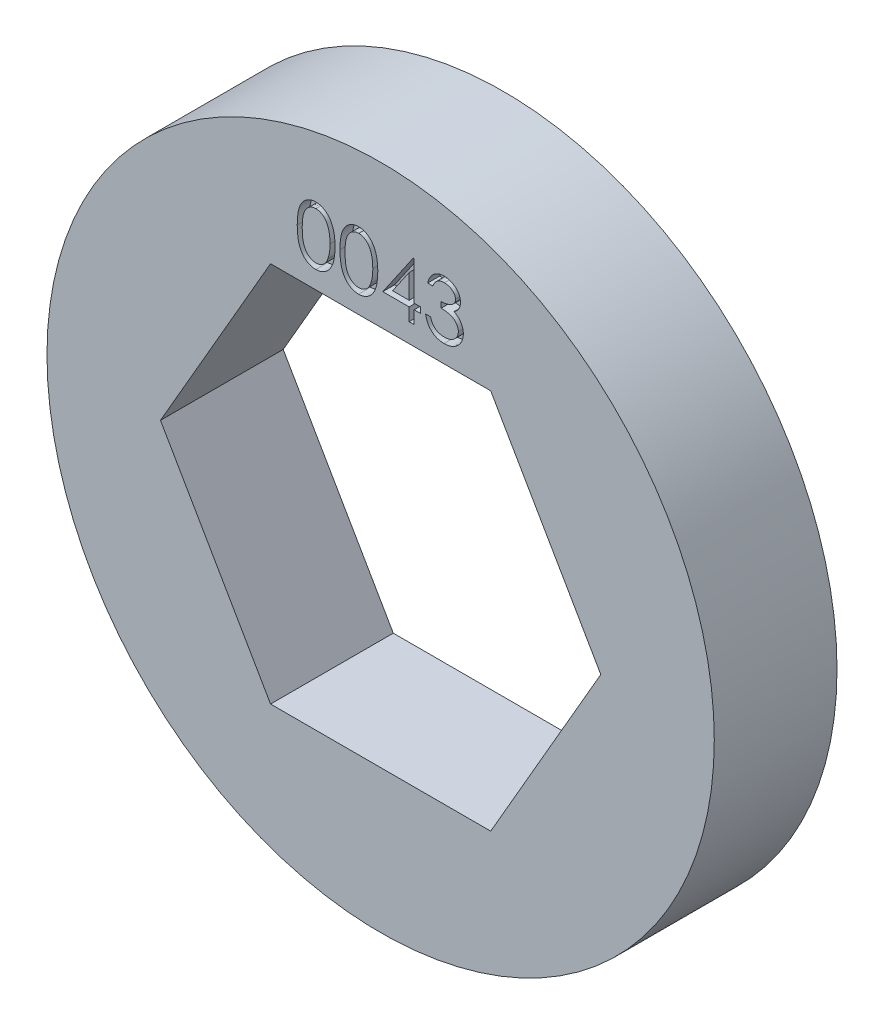
from build123d import *

# Parameters (mm, degrees)
SKETCH1_R           = 11.1125
BOSS_EXTRUDE1_DEPTH = 4.087622
CUT_EXTRUDE1_DEPTH  = 0.4


with BuildPart() as part:
    # Sketch1 → Boss-Extrude1 (new body)
    with BuildSketch(Plane.XY):
        Circle(SKETCH1_R)
        Polygon((3.666174209, 6.35), (-3.666174209, 6.35), (-7.332348419, 0), (-3.666174209, -6.35), (3.666174209, -6.35), (7.332348419, 0), align=None, mode=Mode.SUBTRACT)
    extrude(amount=BOSS_EXTRUDE1_DEPTH)

    # Sketch2 → Cut-Extrude1 (cut)
    # profile 1 of 4: a face of its own
    with BuildSketch(Plane.XY.offset(4.087622)):
        with BuildLine():
            add(Edge.make_bspline(
                [(-2.778125, 7.910299646), (-2.777951424, 7.939984514), (-2.777614249, 7.997647797), (-2.773863293, 8.081671337), (-2.767632175, 8.160496156), (-2.759092815, 8.234126029), (-2.74870105, 8.302579963), (-2.734828689, 8.365675022), (-2.719052747, 8.42370323), (-2.700768745, 8.476853814), (-2.680137706, 8.525842849), (-2.65768291, 8.571576184), (-2.632513206, 8.613984623), (-2.60606709, 8.653745038), (-2.577274035, 8.690206576), (-2.546953425, 8.723884152), (-2.513921849, 8.753999424), (-2.479302174, 8.781434759), (-2.442780962, 8.805485104), (-2.405399217, 8.826669095), (-2.36689964, 8.844766525), (-2.327177119, 8.858996047), (-2.286588682, 8.870749287), (-2.244992442, 8.878786772), (-2.202319721, 8.883843969), (-2.17351642, 8.884327452), (-2.158908837, 8.88457265)],
                knots=[0, 0, 0, 0, 1.646270934, 3.197905019, 4.663502075, 6.030701355, 7.308322542, 8.50163776, 9.611534131, 10.641858119, 11.616356847, 12.558055219, 13.465016945, 14.349605745, 15.204443733, 16.039544428, 16.859896111, 17.680448484, 18.487036065, 19.28249412, 20.06191084, 20.843045899, 21.620316918, 22.403196591, 23.190181807, 24, 24, 24, 24], degree=3))
            add(Edge.make_bspline(
                [(-2.158908837, 8.88457265), (-2.14417923, 8.884314514), (-2.114886675, 8.883801164), (-2.071579477, 8.878867244), (-2.02927277, 8.870680441), (-1.988146922, 8.859080592), (-1.947864117, 8.844689547), (-1.908739434, 8.826651781), (-1.870529853, 8.805655047), (-1.833842576, 8.780983245), (-1.798274842, 8.753475957), (-1.764700295, 8.722380712), (-1.733115879, 8.688011485), (-1.703125197, 8.650735999), (-1.67557911, 8.609839308), (-1.649346502, 8.566032717), (-1.625866299, 8.518550134), (-1.603252534, 8.468183803), (-1.58373317, 8.413540117), (-1.566129782, 8.354927098), (-1.551906328, 8.291652424), (-1.540058671, 8.224048078), (-1.53088033, 8.151865784), (-1.524195557, 8.075260276), (-1.520664383, 7.994181152), (-1.519999379, 7.938746791), (-1.51965812, 7.910299646)],
                knots=[0, 0, 0, 0, 0.810914788, 1.612654377, 2.396697861, 3.181598691, 3.963628158, 4.749916497, 5.551656086, 6.361998678, 7.18212741, 8.025565596, 8.878627764, 9.750805457, 10.657531673, 11.591944965, 12.560506719, 13.57287815, 14.630710178, 15.753379473, 16.941251878, 18.199788006, 19.531962791, 20.947069417, 22.433333509, 24, 24, 24, 24], degree=3))
            add(Edge.make_bspline(
                [(-1.51965812, 7.910299646), (-1.520002916, 7.881976578), (-1.520674739, 7.826790235), (-1.524155971, 7.746075928), (-1.531013247, 7.669876963), (-1.539591033, 7.598010593), (-1.551471334, 7.530775937), (-1.566079068, 7.467940333), (-1.582298197, 7.409232428), (-1.602319109, 7.355133174), (-1.624232276, 7.304887887), (-1.648073984, 7.257968188), (-1.673616767, 7.213959358), (-1.701444978, 7.173213658), (-1.731106576, 7.135442452), (-1.763236406, 7.10131246), (-1.796928757, 7.070001313), (-1.83260116, 7.042139827), (-1.869860606, 7.017753284), (-1.907938951, 6.995944288), (-1.947511825, 6.978358654), (-1.987682429, 6.963258862), (-2.029025356, 6.951722789), (-2.071489071, 6.943746207), (-2.114857579, 6.938151937), (-2.144174241, 6.937725175), (-2.158908837, 6.937510684)],
                knots=[0, 0, 0, 0, 1.561518951, 3.042555995, 4.452378317, 5.7783523, 7.031515105, 8.214008947, 9.334062868, 10.386615937, 11.391082383, 12.354592575, 13.286541444, 14.194233754, 15.072674879, 15.931287219, 16.775624067, 17.606195743, 18.42308326, 19.229000347, 20.022332153, 20.807536673, 21.593273796, 22.3848459, 23.188221202, 24, 24, 24, 24], degree=3))
            add(Edge.make_bspline(
                [(-2.158908837, 6.937510684), (-2.173516014, 6.937757464), (-2.202318516, 6.938244065), (-2.244997091, 6.943278415), (-2.286421551, 6.951372285), (-2.326796308, 6.962705238), (-2.366328506, 6.976577256), (-2.404479458, 6.994650247), (-2.441673357, 7.015464525), (-2.477810972, 7.039168769), (-2.512213241, 7.066326493), (-2.545073753, 7.096364262), (-2.575566992, 7.13003165), (-2.603948367, 7.166797051), (-2.630922156, 7.206322225), (-2.655734449, 7.249146823), (-2.678684859, 7.295101038), (-2.699662873, 7.344481765), (-2.718262374, 7.398009581), (-2.734691787, 7.456296855), (-2.747663862, 7.519858046), (-2.758767342, 7.588182652), (-2.767723161, 7.661564274), (-2.773837325, 7.740042748), (-2.777616271, 7.823569171), (-2.777952329, 7.880861927), (-2.778125, 7.910299646)],
                knots=[0, 0, 0, 0, 0.810891512, 1.598919785, 2.382837074, 3.152667961, 3.926044502, 4.706494248, 5.493654104, 6.291793342, 7.103789334, 7.925228297, 8.761435821, 9.622817696, 10.50288917, 11.416980706, 12.369136599, 13.353924996, 14.394355917, 15.514179734, 16.714354668, 17.994756427, 19.357759367, 20.818452758, 22.365282078, 24, 24, 24, 24], degree=3))
        make_face()
        with BuildLine():
            add(Edge.make_bspline(
                [(-2.611912393, 7.911041667), (-2.611849186, 7.886303814), (-2.611726513, 7.838292498), (-2.608521773, 7.768525439), (-2.604156025, 7.70345364), (-2.598525006, 7.642994477), (-2.590162612, 7.587352596), (-2.58079277, 7.536145305), (-2.569390239, 7.4896436), (-2.555899126, 7.447528384), (-2.540532604, 7.409084918), (-2.523754917, 7.373312609), (-2.505731118, 7.339788876), (-2.485559734, 7.308814841), (-2.463591347, 7.280289496), (-2.440322164, 7.253707956), (-2.414883755, 7.230002886), (-2.379692191, 7.201572426), (-2.333233223, 7.172193551), (-2.274696566, 7.146610411), (-2.21454701, 7.130533028), (-2.17372114, 7.128488457), (-2.153343683, 7.127467949)],
                knots=[0, 0, 0, 0, 1.459021318, 2.831673884, 4.118529203, 5.306027144, 6.411944654, 7.436330062, 8.375795394, 9.233974572, 10.042671642, 10.816086306, 11.563610507, 12.285937304, 12.993564865, 13.685989202, 14.367179055, 15.041617293, 16.353048772, 17.594441528, 18.799311195, 20, 20, 20, 20], degree=3))
            add(Edge.make_bspline(
                [(-2.153343683, 7.127467949), (-2.132834415, 7.128313441), (-2.091858223, 7.13000268), (-2.03199159, 7.146300345), (-1.973873072, 7.170890477), (-1.928326671, 7.199966865), (-1.893675491, 7.227657273), (-1.868848584, 7.251265857), (-1.846061583, 7.277700837), (-1.824449319, 7.306222548), (-1.804627225, 7.337375904), (-1.786602148, 7.3710111), (-1.770153876, 7.40722154), (-1.760782839, 7.432499694), (-1.75599167, 7.445423761)],
                knots=[0, 0, 0, 0, 1.353760809, 2.704726607, 4.075137775, 5.516104923, 6.260822281, 7.007110065, 7.778089737, 8.566572457, 9.372053459, 10.217411131, 11.088608312, 12, 12, 12, 12], degree=3))
            add(Edge.make_bspline(
                [(-1.75599167, 7.445423761), (-1.750408026, 7.461949498), (-1.739070835, 7.495503832), (-1.724459604, 7.547554598), (-1.712952664, 7.602166061), (-1.702600383, 7.659011851), (-1.695534391, 7.718511193), (-1.689847006, 7.780479988), (-1.686497018, 7.844964959), (-1.686081754, 7.888777308), (-1.685870726, 7.911041667)],
                knots=[0, 0, 0, 0, 0.884706709, 1.796334032, 2.740027952, 3.714592787, 4.726048262, 5.777819803, 6.87074269, 8, 8, 8, 8], degree=3))
            add(Edge.make_bspline(
                [(-1.685870726, 7.911041667), (-1.686161868, 7.933302424), (-1.686731404, 7.976849223), (-1.688908389, 8.040623427), (-1.694530031, 8.101195951), (-1.700773731, 8.158827743), (-1.70997976, 8.213199778), (-1.719905767, 8.264767231), (-1.733241408, 8.312891248), (-1.747486456, 8.358325277), (-1.76379029, 8.400553123), (-1.781737366, 8.439771669), (-1.800904713, 8.476170252), (-1.821723316, 8.509649009), (-1.843946031, 8.540357896), (-1.868159401, 8.567681202), (-1.893402965, 8.592465765), (-1.928760392, 8.620756374), (-1.975048871, 8.649602146), (-2.032646359, 8.676148194), (-2.092585408, 8.691392582), (-2.133105528, 8.693541892), (-2.153343683, 8.694615385)],
                knots=[0, 0, 0, 0, 1.31362396, 2.569729283, 3.763502607, 4.902122613, 5.988968491, 7.01645872, 7.998833611, 8.933434873, 9.825090667, 10.667526885, 11.477055099, 12.250526234, 12.991942729, 13.710640831, 14.402115721, 15.076753259, 16.378508321, 17.609869233, 18.806226677, 20, 20, 20, 20], degree=3))
            add(Edge.make_bspline(
                [(-2.153343683, 8.694615385), (-2.173828038, 8.693540411), (-2.214834066, 8.691388505), (-2.275396108, 8.676204991), (-2.333447995, 8.649739797), (-2.379614069, 8.620660833), (-2.414996156, 8.592965143), (-2.439910748, 8.568948145), (-2.46327143, 8.542677002), (-2.484791422, 8.513889322), (-2.504947001, 8.482951398), (-2.523457787, 8.449619844), (-2.540135707, 8.413725747), (-2.555526274, 8.37529955), (-2.569058541, 8.333187967), (-2.580220763, 8.286743541), (-2.590532662, 8.235699123), (-2.597832659, 8.179755883), (-2.604322229, 8.119281577), (-2.608492776, 8.05404733), (-2.611737233, 7.984163262), (-2.611852837, 7.935903707), (-2.611912393, 7.911041667)],
                knots=[0, 0, 0, 0, 1.207732386, 2.417664972, 3.655092373, 4.956220595, 5.625982001, 6.301752483, 6.994047911, 7.697131622, 8.419323945, 9.170223765, 9.943494443, 10.752040957, 11.610060368, 12.549350801, 13.567764191, 14.679664412, 15.874934091, 17.154273443, 18.533957287, 20, 20, 20, 20], degree=3))
        make_face(mode=Mode.SUBTRACT)
    # profile 2 of 4: a face of its own
    with BuildSketch(Plane.XY.offset(4.087622)):
        with BuildLine():
            add(Edge.make_bspline(
                [(-1.353445513, 7.910299646), (-1.353271937, 7.939984514), (-1.352934762, 7.997647797), (-1.349183806, 8.081671337), (-1.342952687, 8.160496156), (-1.334413328, 8.234126029), (-1.324021563, 8.302579963), (-1.310149201, 8.365675022), (-1.29437326, 8.42370323), (-1.276089257, 8.476853814), (-1.255458219, 8.525842849), (-1.233003423, 8.571576184), (-1.207833719, 8.613984623), (-1.181387603, 8.653745038), (-1.152594548, 8.690206576), (-1.122273938, 8.723884152), (-1.089242362, 8.753999424), (-1.054622687, 8.781434759), (-1.018101474, 8.805485104), (-0.98071973, 8.826669095), (-0.942220153, 8.844766525), (-0.902497632, 8.858996047), (-0.861909195, 8.870749287), (-0.820312955, 8.878786772), (-0.777640233, 8.883843969), (-0.748836933, 8.884327452), (-0.73422935, 8.88457265)],
                knots=[0, 0, 0, 0, 1.646270934, 3.197905019, 4.663502075, 6.030701355, 7.308322542, 8.50163776, 9.611534131, 10.641858119, 11.616356847, 12.558055219, 13.465016945, 14.349605745, 15.204443733, 16.039544428, 16.859896111, 17.680448484, 18.487036065, 19.28249412, 20.06191084, 20.843045899, 21.620316918, 22.403196591, 23.190181807, 24, 24, 24, 24], degree=3))
            add(Edge.make_bspline(
                [(-0.73422935, 8.88457265), (-0.719499743, 8.884314514), (-0.690207188, 8.883801164), (-0.64689999, 8.878867244), (-0.604593283, 8.870680441), (-0.563467435, 8.859080592), (-0.523184629, 8.844689547), (-0.484059947, 8.826651781), (-0.445850366, 8.805655047), (-0.409163089, 8.780983245), (-0.373595355, 8.753475957), (-0.340020808, 8.722380712), (-0.308436392, 8.688011485), (-0.278445709, 8.650735999), (-0.250899623, 8.609839308), (-0.224667015, 8.566032717), (-0.201186812, 8.518550134), (-0.178573047, 8.468183803), (-0.159053683, 8.413540117), (-0.141450295, 8.354927098), (-0.127226841, 8.291652424), (-0.115379184, 8.224048078), (-0.106200843, 8.151865784), (-0.09951607, 8.075260276), (-0.095984896, 7.994181152), (-0.095319891, 7.938746791), (-0.094978632, 7.910299646)],
                knots=[0, 0, 0, 0, 0.810914788, 1.612654377, 2.396697861, 3.181598691, 3.963628158, 4.749916497, 5.551656086, 6.361998678, 7.18212741, 8.025565596, 8.878627764, 9.750805457, 10.657531673, 11.591944965, 12.560506719, 13.57287815, 14.630710178, 15.753379473, 16.941251878, 18.199788006, 19.531962791, 20.947069417, 22.433333509, 24, 24, 24, 24], degree=3))
            add(Edge.make_bspline(
                [(-0.094978632, 7.910299646), (-0.095323429, 7.881976578), (-0.095995252, 7.826790235), (-0.099476484, 7.746075928), (-0.10633376, 7.669876963), (-0.114911545, 7.598010593), (-0.126791847, 7.530775937), (-0.14139958, 7.467940333), (-0.15761871, 7.409232428), (-0.177639621, 7.355133174), (-0.199552789, 7.304887887), (-0.223394497, 7.257968188), (-0.24893728, 7.213959358), (-0.276765491, 7.173213658), (-0.306427089, 7.135442452), (-0.338556919, 7.10131246), (-0.37224927, 7.070001313), (-0.407921673, 7.042139827), (-0.445181119, 7.017753284), (-0.483259464, 6.995944288), (-0.522832338, 6.978358654), (-0.563002942, 6.963258862), (-0.604345869, 6.951722789), (-0.646809584, 6.943746207), (-0.690178092, 6.938151937), (-0.719494754, 6.937725175), (-0.73422935, 6.937510684)],
                knots=[0, 0, 0, 0, 1.561518951, 3.042555995, 4.452378317, 5.7783523, 7.031515105, 8.214008947, 9.334062868, 10.386615937, 11.391082383, 12.354592575, 13.286541444, 14.194233754, 15.072674879, 15.931287219, 16.775624067, 17.606195743, 18.42308326, 19.229000347, 20.022332153, 20.807536673, 21.593273796, 22.3848459, 23.188221202, 24, 24, 24, 24], degree=3))
            add(Edge.make_bspline(
                [(-0.73422935, 6.937510684), (-0.748836527, 6.937757464), (-0.777639029, 6.938244065), (-0.820317604, 6.943278415), (-0.861742064, 6.951372285), (-0.902116821, 6.962705238), (-0.941649019, 6.976577256), (-0.979799971, 6.994650247), (-1.01699387, 7.015464525), (-1.053131485, 7.039168769), (-1.087533753, 7.066326493), (-1.120394265, 7.096364262), (-1.150887505, 7.13003165), (-1.17926888, 7.166797051), (-1.206242669, 7.206322225), (-1.231054962, 7.249146823), (-1.254005372, 7.295101038), (-1.274983386, 7.344481765), (-1.293582887, 7.398009581), (-1.310012299, 7.456296855), (-1.322984374, 7.519858046), (-1.334087855, 7.588182652), (-1.343043674, 7.661564274), (-1.349157838, 7.740042748), (-1.352936784, 7.823569171), (-1.353272842, 7.880861927), (-1.353445513, 7.910299646)],
                knots=[0, 0, 0, 0, 0.810891512, 1.598919785, 2.382837074, 3.152667961, 3.926044502, 4.706494248, 5.493654104, 6.291793342, 7.103789334, 7.925228297, 8.761435821, 9.622817696, 10.50288917, 11.416980706, 12.369136599, 13.353924996, 14.394355917, 15.514179734, 16.714354668, 17.994756427, 19.357759367, 20.818452758, 22.365282078, 24, 24, 24, 24], degree=3))
        make_face()
        with BuildLine():
            add(Edge.make_bspline(
                [(-1.187232906, 7.911041667), (-1.187169699, 7.886303814), (-1.187047025, 7.838292498), (-1.183842286, 7.768525439), (-1.179476538, 7.70345364), (-1.173845518, 7.642994477), (-1.165483125, 7.587352596), (-1.156113283, 7.536145305), (-1.144710752, 7.4896436), (-1.131219639, 7.447528384), (-1.115853116, 7.409084918), (-1.09907543, 7.373312609), (-1.081051631, 7.339788876), (-1.060880247, 7.308814841), (-1.03891186, 7.280289496), (-1.015642677, 7.253707956), (-0.990204267, 7.230002886), (-0.955012704, 7.201572426), (-0.908553736, 7.172193551), (-0.850017078, 7.146610411), (-0.789867523, 7.130533028), (-0.749041653, 7.128488457), (-0.728664196, 7.127467949)],
                knots=[0, 0, 0, 0, 1.459021318, 2.831673884, 4.118529203, 5.306027144, 6.411944654, 7.436330062, 8.375795394, 9.233974572, 10.042671642, 10.816086306, 11.563610507, 12.285937304, 12.993564865, 13.685989202, 14.367179055, 15.041617293, 16.353048772, 17.594441528, 18.799311195, 20, 20, 20, 20], degree=3))
            add(Edge.make_bspline(
                [(-0.728664196, 7.127467949), (-0.708154928, 7.128313441), (-0.667178736, 7.13000268), (-0.607312103, 7.146300345), (-0.549193585, 7.170890477), (-0.503647183, 7.199966865), (-0.468996004, 7.227657273), (-0.444169097, 7.251265857), (-0.421382096, 7.277700837), (-0.399769832, 7.306222548), (-0.379947737, 7.337375904), (-0.36192266, 7.3710111), (-0.345474389, 7.40722154), (-0.336103352, 7.432499694), (-0.331312183, 7.445423761)],
                knots=[0, 0, 0, 0, 1.353760809, 2.704726607, 4.075137775, 5.516104923, 6.260822281, 7.007110065, 7.778089737, 8.566572457, 9.372053459, 10.217411131, 11.088608312, 12, 12, 12, 12], degree=3))
            add(Edge.make_bspline(
                [(-0.331312183, 7.445423761), (-0.325728539, 7.461949498), (-0.314391348, 7.495503832), (-0.299780117, 7.547554598), (-0.288273177, 7.602166061), (-0.277920896, 7.659011851), (-0.270854903, 7.718511193), (-0.265167519, 7.780479988), (-0.26181753, 7.844964959), (-0.261402266, 7.888777308), (-0.261191239, 7.911041667)],
                knots=[0, 0, 0, 0, 0.884706709, 1.796334032, 2.740027952, 3.714592787, 4.726048262, 5.777819803, 6.87074269, 8, 8, 8, 8], degree=3))
            add(Edge.make_bspline(
                [(-0.261191239, 7.911041667), (-0.261482381, 7.933302424), (-0.262051917, 7.976849223), (-0.264228902, 8.040623427), (-0.269850543, 8.101195951), (-0.276094244, 8.158827743), (-0.285300273, 8.213199778), (-0.295226279, 8.264767231), (-0.308561921, 8.312891248), (-0.322806969, 8.358325277), (-0.339110803, 8.400553123), (-0.357057879, 8.439771669), (-0.376225226, 8.476170252), (-0.397043828, 8.509649009), (-0.419266544, 8.540357896), (-0.443479914, 8.567681202), (-0.468723478, 8.592465765), (-0.504080905, 8.620756374), (-0.550369384, 8.649602146), (-0.607966872, 8.676148194), (-0.667905921, 8.691392582), (-0.708426041, 8.693541892), (-0.728664196, 8.694615385)],
                knots=[0, 0, 0, 0, 1.31362396, 2.569729283, 3.763502607, 4.902122613, 5.988968491, 7.01645872, 7.998833611, 8.933434873, 9.825090667, 10.667526885, 11.477055099, 12.250526234, 12.991942729, 13.710640831, 14.402115721, 15.076753259, 16.378508321, 17.609869233, 18.806226677, 20, 20, 20, 20], degree=3))
            add(Edge.make_bspline(
                [(-0.728664196, 8.694615385), (-0.749148551, 8.693540411), (-0.790154579, 8.691388505), (-0.850716621, 8.676204991), (-0.908768507, 8.649739797), (-0.954934581, 8.620660833), (-0.990316668, 8.592965143), (-1.01523126, 8.568948145), (-1.038591943, 8.542677002), (-1.060111935, 8.513889322), (-1.080267514, 8.482951398), (-1.098778299, 8.449619844), (-1.11545622, 8.413725747), (-1.130846787, 8.37529955), (-1.144379054, 8.333187967), (-1.155541276, 8.286743541), (-1.165853175, 8.235699123), (-1.173153171, 8.179755883), (-1.179642742, 8.119281577), (-1.183813289, 8.05404733), (-1.187057746, 7.984163262), (-1.18717335, 7.935903707), (-1.187232906, 7.911041667)],
                knots=[0, 0, 0, 0, 1.207732386, 2.417664972, 3.655092373, 4.956220595, 5.625982001, 6.301752483, 6.994047911, 7.697131622, 8.419323945, 9.170223765, 9.943494443, 10.752040957, 11.610060368, 12.549350801, 13.567764191, 14.679664412, 15.874934091, 17.154273443, 18.533957287, 20, 20, 20, 20], degree=3))
        make_face(mode=Mode.SUBTRACT)
    # profile 3 of 4: a face of its own
    with BuildSketch(Plane.XY.offset(4.087622)):
        Polygon((1.082236996, 8.88457265), (1.115998932, 8.88457265), (1.115998932, 7.602361111), (1.329700855, 7.602361111), (1.329700855, 7.412403846), (1.115998932, 7.412403846), (1.115998932, 6.985), (0.949786325, 6.985), (0.949786325, 7.412403846), (0.071233974, 7.412403846), align=None)
        Polygon((0.949786325, 7.602361111), (0.949786325, 8.406711405), (0.397723024, 7.602361111), align=None, mode=Mode.SUBTRACT)
    # profile 4 of 4: a face of its own
    with BuildSketch(Plane.XY.offset(4.087622)):
        with BuildLine():
            Line((1.733360043, 8.409679487), (1.567147436, 8.409679487))
            add(Edge.make_bspline(
                [(1.567147436, 8.409679487), (1.571650406, 8.428323343), (1.580453346, 8.464770557), (1.598814145, 8.516844399), (1.618816251, 8.566122263), (1.642834652, 8.611681435), (1.669033034, 8.654437521), (1.699048808, 8.693420766), (1.731497161, 8.729622627), (1.767387863, 8.761750048), (1.80502678, 8.79084243), (1.844944266, 8.815647148), (1.886337214, 8.836985346), (1.929492414, 8.854564385), (1.974538346, 8.867807058), (2.021067772, 8.877415034), (2.069202624, 8.883654499), (2.101877391, 8.884263444), (2.118468717, 8.88457265)],
                knots=[0, 0, 0, 0, 1.162005537, 2.271625781, 3.343758855, 4.383309926, 5.390229558, 6.379919256, 7.361854164, 8.333198761, 9.295911338, 10.242430842, 11.177959212, 12.116337295, 13.062827104, 14.020064771, 14.994644689, 16, 16, 16, 16], degree=3))
            add(Edge.make_bspline(
                [(2.118468717, 8.88457265), (2.142642501, 8.883842807), (2.190462769, 8.882399042), (2.260716548, 8.869215152), (2.328464073, 8.848352686), (2.3929638, 8.819527006), (2.452875221, 8.783973719), (2.506181453, 8.741659046), (2.552159957, 8.693399416), (2.590733232, 8.6400951), (2.620935419, 8.583127393), (2.643206125, 8.524495643), (2.656764264, 8.464338934), (2.658521392, 8.42372154), (2.659401709, 8.403372312)],
                knots=[0, 0, 0, 0, 1.083050992, 2.142477498, 3.193116406, 4.255571735, 5.30263384, 6.308962982, 7.297363603, 8.282367274, 9.249857812, 10.179914175, 11.08814088, 12, 12, 12, 12], degree=3))
            add(Edge.make_bspline(
                [(2.659401709, 8.403372312), (2.658785976, 8.38378955), (2.657581081, 8.345469123), (2.647350328, 8.289524831), (2.630133222, 8.236797818), (2.606283806, 8.187066119), (2.575411403, 8.140645058), (2.538013767, 8.097430191), (2.493826942, 8.057229845), (2.460341837, 8.03420079), (2.443102714, 8.022344752)],
                knots=[0, 0, 0, 0, 1.024540389, 2.004866551, 2.965041327, 3.920577974, 4.882998113, 5.874504559, 6.905732034, 8, 8, 8, 8], degree=3))
            add(Edge.make_bspline(
                [(2.443102714, 8.022344752), (2.462804518, 8.012831302), (2.501839489, 7.993982408), (2.555047477, 7.95701707), (2.603348686, 7.914336419), (2.630285238, 7.881029266), (2.643819278, 7.864294371)],
                knots=[0, 0, 0, 0, 1.015518401, 2.012035669, 3.001164323, 4, 4, 4, 4], degree=3))
            add(Edge.make_bspline(
                [(2.643819278, 7.864294371), (2.652731155, 7.852092977), (2.67040897, 7.827889997), (2.69222944, 7.788976971), (2.712025097, 7.749632641), (2.727450421, 7.708802456), (2.739395759, 7.666959653), (2.747934409, 7.624032385), (2.75323885, 7.579985598), (2.753998497, 7.55018691), (2.754380342, 7.53520825)],
                knots=[0, 0, 0, 0, 1.025084078, 2.033381695, 3.024893161, 4.013698104, 4.991890475, 5.976764909, 6.982997093, 8, 8, 8, 8], degree=3))
            add(Edge.make_bspline(
                [(2.754380342, 7.53520825), (2.753430745, 7.509273939), (2.75153602, 7.457527365), (2.734600531, 7.381076158), (2.708346858, 7.30634433), (2.671063396, 7.234867227), (2.625625173, 7.167990942), (2.571566922, 7.108154729), (2.509502864, 7.056720467), (2.440284875, 7.013746722), (2.365292894, 6.979394321), (2.285084144, 6.955551424), (2.200814323, 6.940022499), (2.143025462, 6.938357281), (2.113645583, 6.937510684)],
                knots=[0, 0, 0, 0, 0.955779014, 1.907060117, 2.875433937, 3.871313158, 4.872415639, 5.851225146, 6.836215519, 7.83643374, 8.849228613, 9.86973379, 10.916971861, 12, 12, 12, 12], degree=3))
            add(Edge.make_bspline(
                [(2.113645583, 6.937510684), (2.093844537, 6.937970113), (2.05488268, 6.938874117), (1.997603829, 6.945054044), (1.94292943, 6.956341172), (1.890785559, 6.971530004), (1.841125894, 6.990787301), (1.794101972, 7.014768445), (1.749424486, 7.042979115), (1.707515041, 7.075752305), (1.668378633, 7.112413681), (1.633055316, 7.153614074), (1.600956176, 7.198591867), (1.572940696, 7.247869484), (1.547732809, 7.300810099), (1.526999552, 7.358091596), (1.508750939, 7.419201891), (1.500266564, 7.461788029), (1.495913462, 7.483637821)],
                knots=[0, 0, 0, 0, 1.048658725, 2.063410685, 3.046034179, 4.001477787, 4.936774919, 5.862367409, 6.792675028, 7.730719943, 8.675894397, 9.627829632, 10.600096036, 11.597688215, 12.626045268, 13.701542398, 14.82072376, 16, 16, 16, 16], degree=3))
            Line((1.495913462, 7.483637821), (1.662126068, 7.483637821))
            add(Edge.make_bspline(
                [(1.662126068, 7.483637821), (1.666456393, 7.469377301), (1.674879252, 7.441639352), (1.689216651, 7.401718857), (1.705551112, 7.36512272), (1.723074232, 7.331582485), (1.741477827, 7.300767839), (1.762070308, 7.2734936), (1.783326481, 7.248561805), (1.799349305, 7.234515281), (1.807191089, 7.227640725)],
                knots=[0, 0, 0, 0, 1.198163088, 2.33053128, 3.407730985, 4.417276592, 5.372219308, 6.28897303, 7.162600585, 8, 8, 8, 8], degree=3))
            add(Edge.make_bspline(
                [(1.807191089, 7.227640725), (1.817560944, 7.219645898), (1.838268645, 7.203680923), (1.872012667, 7.183307145), (1.907501169, 7.165653602), (1.945503101, 7.15216848), (1.985198417, 7.140750301), (2.027228731, 7.133278193), (2.071223234, 7.128151536), (2.101262842, 7.127699135), (2.116613665, 7.127467949)],
                knots=[0, 0, 0, 0, 0.946170439, 1.889420265, 2.845303464, 3.807233317, 4.801018734, 5.828864929, 6.890507805, 8, 8, 8, 8], degree=3))
            add(Edge.make_bspline(
                [(2.116613665, 7.127467949), (2.133945727, 7.127793865), (2.167837078, 7.128431167), (2.217290274, 7.134292062), (2.264337132, 7.142827739), (2.308455305, 7.156010859), (2.350222698, 7.17229906), (2.389053821, 7.192750507), (2.425458428, 7.216745423), (2.458970238, 7.244018227), (2.489103902, 7.273874602), (2.515636061, 7.305102352), (2.538191611, 7.337569812), (2.556386255, 7.371456651), (2.570753421, 7.406622543), (2.580534115, 7.443166173), (2.587334708, 7.480788477), (2.58788854, 7.506362556), (2.588167735, 7.519254808)],
                knots=[0, 0, 0, 0, 1.217147791, 2.380027433, 3.494444702, 4.572153297, 5.609568379, 6.639424714, 7.649109417, 8.668170816, 9.669597737, 10.625200337, 11.543417969, 12.441394052, 13.322311151, 14.205496177, 15.095365482, 16, 16, 16, 16], degree=3))
            add(Edge.make_bspline(
                [(2.588167735, 7.519254808), (2.58735795, 7.536511641), (2.585742411, 7.570939441), (2.573408287, 7.62158999), (2.553120638, 7.670391546), (2.524718935, 7.716511485), (2.490145445, 7.759255399), (2.449735682, 7.797393226), (2.403154077, 7.828862815), (2.360281063, 7.850605563), (2.322305335, 7.865441848), (2.28980636, 7.875324017), (2.253422658, 7.883692077), (2.213594215, 7.89147732), (2.17002093, 7.8981032), (2.122750239, 7.903628661), (2.071772566, 7.90804987), (2.036481824, 7.910024242), (2.01829594, 7.911041667)],
                knots=[0, 0, 0, 0, 1.07054697, 2.135767047, 3.216561865, 4.33974944, 5.486079747, 6.621378074, 7.775625952, 8.963672916, 9.598146892, 10.304877434, 11.070270905, 11.915000392, 12.823868403, 13.805723172, 14.86925407, 16, 16, 16, 16], degree=3))
            Line((2.01829594, 7.911041667), (2.01829594, 8.100998932))
            add(Edge.make_bspline(
                [(2.01829594, 8.100998932), (2.041209474, 8.101387765), (2.086091457, 8.102149395), (2.151652193, 8.111361134), (2.214344321, 8.124103799), (2.272778472, 8.143622214), (2.326038416, 8.166291871), (2.372245039, 8.192671998), (2.410750988, 8.221995636), (2.441369138, 8.254715392), (2.464403355, 8.289807105), (2.481245035, 8.326381336), (2.491193541, 8.364758652), (2.492521573, 8.39094958), (2.493189103, 8.404114333)],
                knots=[0, 0, 0, 0, 1.321986639, 2.589447074, 3.816329219, 5.01088745, 6.139805852, 7.153945165, 8.075214402, 8.924034688, 9.728124013, 10.488707548, 11.240355623, 12, 12, 12, 12], degree=3))
            add(Edge.make_bspline(
                [(2.493189103, 8.404114333), (2.49296981, 8.413786306), (2.492533538, 8.433028239), (2.487031645, 8.461140254), (2.478763924, 8.488392838), (2.467397567, 8.514670096), (2.45218392, 8.539789783), (2.433977419, 8.563966058), (2.412298466, 8.587060891), (2.3874565, 8.60858756), (2.360780253, 8.629102948), (2.331543914, 8.646519748), (2.300629005, 8.661413176), (2.2680013, 8.673694871), (2.233554916, 8.682933745), (2.197451696, 8.689567294), (2.159622796, 8.69371472), (2.133814421, 8.69431184), (2.120694778, 8.694615385)],
                knots=[0, 0, 0, 0, 0.884392785, 1.759457502, 2.611959086, 3.489218968, 4.37281399, 5.2945488, 6.255912374, 7.266815255, 8.301784654, 9.332968512, 10.37626691, 11.440494194, 12.520033166, 13.637162961, 14.798855837, 16, 16, 16, 16], degree=3))
            add(Edge.make_bspline(
                [(2.120694778, 8.694615385), (2.099606604, 8.693879122), (2.058416495, 8.692441031), (1.999036101, 8.679845269), (1.943833787, 8.659748533), (1.901638743, 8.635759811), (1.870480047, 8.612079373), (1.848214334, 8.591398277), (1.826348897, 8.568415074), (1.806322227, 8.541714184), (1.786068914, 8.513103841), (1.767630333, 8.481129643), (1.749712913, 8.446625651), (1.738916564, 8.422233377), (1.733360043, 8.409679487)],
                knots=[0, 0, 0, 0, 1.472543308, 2.876219568, 4.221790263, 5.565193594, 6.249813518, 6.953379497, 7.687249741, 8.463570142, 9.283606569, 10.136032583, 11.040678096, 12, 12, 12, 12], degree=3))
        make_face()
    extrude(amount=-CUT_EXTRUDE1_DEPTH, mode=Mode.SUBTRACT)


solid = part.part
